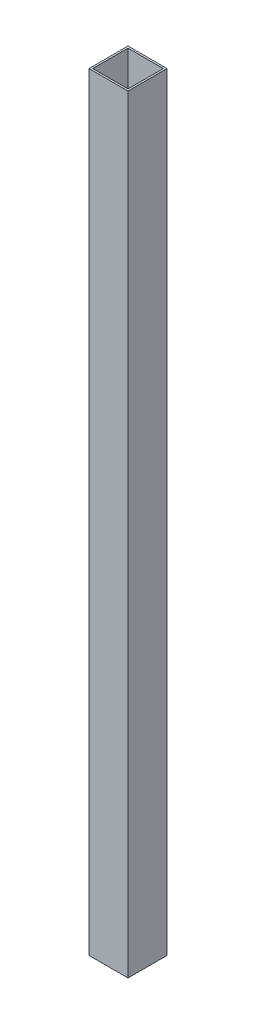
from build123d import *

# Parameters (mm, degrees)
SKETCH2_W           = 25.4
SKETCH2_H           = 25.4
SKETCH2_W_2         = 23
SKETCH2_H_2         = 23
BOSS_EXTRUDE1_DEPTH = 500


with BuildPart() as part:
    # Sketch2 → Boss-Extrude1 (new body)
    with BuildSketch(Plane(origin=(0, 0, 0), x_dir=(1, 0, 0), z_dir=(0, 1, 0))):
        Rectangle(SKETCH2_W, SKETCH2_H)
        Rectangle(SKETCH2_W_2, SKETCH2_H_2, mode=Mode.SUBTRACT)
    extrude(amount=BOSS_EXTRUDE1_DEPTH)


solid = part.part
